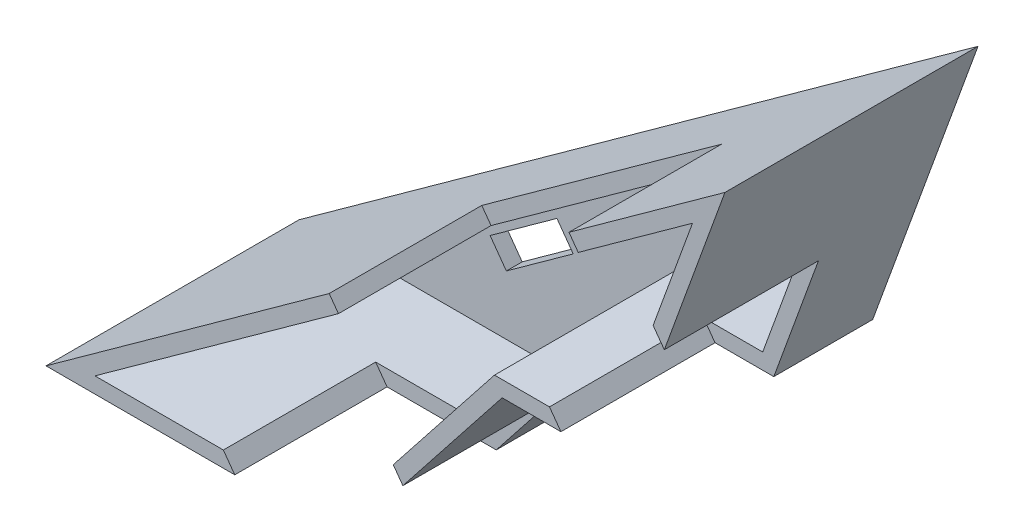
from build123d import *

# Parameters (mm, degrees)
SHELL_3_T            = 2
SKETCH_10_W          = 22.765402734
SKETCH_10_H          = 19.26138917
SKETCH_10_W_2        = 19.681614291
SKETCH_10_H_2        = 19.489043198
CUT_EXTRUDE_8_DEPTH  = 49
SKETCH_9_W           = 37.384578993
SKETCH_9_H           = 19.297136137
CUT_EXTRUDE_5_DEPTH  = 10
CUT_EXTRUDE_10_DEPTH = 49
HOLE_WIZARD_4_40_1_D = 2.2606
HOLE_WIZARD_4_40_2_D = 2.2606


with BuildPart() as part:
    # 草图5 → 放样2 section 0
    with BuildSketch(Plane.XY):
        with BuildLine():
            Line((123.949416554, -29.058070489), (134.559011277, 0.091551442))
            Line((134.559011277, 0.091551442), (59.000774753, -54.400934133))
            Line((59.000774753, -54.400934133), (89.51414806, -54.400934133))
            Line((89.51414806, -54.400934133), (109.519294053, -29.058070489))
            Line((109.519294053, -29.058070489), (123.949416554, -29.058070489))
        make_face()
    # 草图2 → 放样2 section 1
    with BuildSketch(Plane.XY.offset(-30)):
        with BuildLine():
            Line((134.559011277, 0.091551442), (123.949416554, -29.058070489))
            Line((123.949416554, -29.058070489), (109.519294053, -29.058070489))
            Line((109.519294053, -29.058070489), (89.51414806, -54.400934133))
            Line((89.51414806, -54.400934133), (59.000774753, -54.400934133))
            Line((59.000774753, -54.400934133), (134.559011277, 0.091551442))
        make_face()
    loft()

    # 抽壳3
    shell_3_openings = [part.faces().sort_by_distance(p)[0] for p in [
        (99.793796859, -32.953132271, 0),
    ]]
    offset(amount=SHELL_3_T, openings=shell_3_openings, kind=Kind.INTERSECTION)

    # 草图10 → 切除-拉伸8 (cut)
    with BuildSketch(Plane(origin=(45.99732156, -63.779004852, 0), x_dir=(0.8110731554347567, 0.5849447294686114, 0), z_dir=(0.5849447294686114, -0.8110731554347567, 0))):
        with Locations((40.58343187, -9.630694585)):
            Rectangle(SKETCH_10_W, SKETCH_10_H)
        with Locations((87.31465052, -9.744521599)):
            Rectangle(SKETCH_10_W_2, SKETCH_10_H_2)
    extrude(amount=CUT_EXTRUDE_8_DEPTH, mode=Mode.SUBTRACT)

    # 草图9 → 切除-拉伸5 (cut)
    with BuildSketch(Plane(origin=(44.827432101, -62.156858541, 0), x_dir=(0.8110731554347567, 0.5849447294686114, 0), z_dir=(-0.5849447294686114, 0.8110731554347567, 0))):
        with Locations((72.683721601, 9.648568069)):
            Rectangle(SKETCH_9_W, SKETCH_9_H)
    extrude(amount=-CUT_EXTRUDE_5_DEPTH, mode=Mode.SUBTRACT)

    # 草图13 → 切除-拉伸10 (cut)
    with BuildSketch(Plane.XY.offset(-30)):
        Polygon((78.963932985, -44.04826302), (81.023403307, -46.903885112), (89.476536517, -40.807498262), (87.417066196, -37.95187617), align=None)
        Polygon((103.880127445, -22.95550088), (118.225703578, -12.609493132), (120.471275674, -15.723160378), (106.12569954, -26.069168127), align=None)
    extrude(amount=-CUT_EXTRUDE_10_DEPTH, mode=Mode.SUBTRACT)

    # #4-40 螺纹孔1 (through all)
    with Locations(Plane.XY.offset(-30)):
        with Locations((70.84358475, -49.576264772), (125.397426015, -10.123362112)):
            Hole(HOLE_WIZARD_4_40_1_D / 2)

    # #4-40 螺纹孔2 (through all)
    with Locations(Plane(origin=(0, 0, -32), x_dir=(-1, 0, 0), z_dir=(0, 0, -1))):
        with Locations((-116.687059717, -21.559199557)):
            Hole(HOLE_WIZARD_4_40_2_D / 2)


solid = part.part
